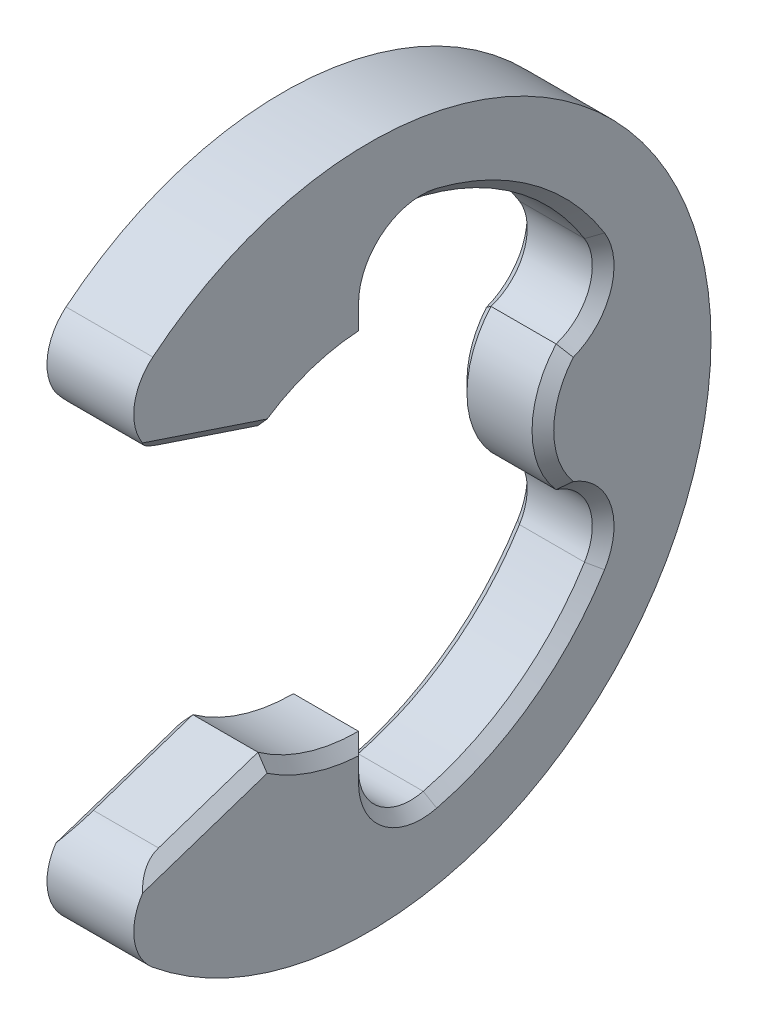
from build123d import *

# Parameters (mm, degrees)
EXTRUDE1_DEPTH          = 1
FILLET1_R               = 1.2
CUT_EXTRUDE1_DEPTH      = 12.181737343
CUT_EXTRUDE1_DEPTH_BACK = 12.181737343
CHAMFER1_SIZE           = 0.25


with BuildPart() as part:
    # Sketch1 → Extrude1 (new, symmetric)
    with BuildSketch(Plane(origin=(0, 0, 0), x_dir=(0, 0, -1), z_dir=(1, 0, 0))):
        with BuildLine():
            Line((-6.381117354, -4.614863629), (-2.317843826, -3.26))
            ThreePointArc((-2.317843826, -3.26), (-1.216552506, -3.810511777), (0, -4))
            Line((0, -4), (0, -6.129032258))
            ThreePointArc((0, -6.129032258), (3.615250795, -4.949242175), (5.8386874, -1.864072388))
            Line((5.8386874, -1.864072388), (3.810511777, -1.216552506))
            ThreePointArc((3.810511777, -1.216552506), (4, 0), (3.810511777, 1.216552506))
            Line((3.810511777, 1.216552506), (5.8386874, 1.864072388))
            ThreePointArc((5.8386874, 1.864072388), (3.615250795, 4.949242175), (0, 6.129032258))
            Line((0, 6.129032258), (0, 4))
            ThreePointArc((0, 4), (-1.216552506, 3.810511777), (-2.317843826, 3.26))
            Line((-2.317843826, 3.26), (-6.381117354, 4.614863629))
            ThreePointArc((-6.381117354, 4.614863629), (7.875, 0), (-6.381117354, -4.614863629))
        make_face()
    extrude(amount=EXTRUDE1_DEPTH, both=True)

    # Fillet1
    fillet1_edges = [part.edges().sort_by_distance(p)[0] for p in [
        (0, -4.614863629, 6.381117354),
        (0, -6.129032258, 0),
        (0, -1.864072388, -5.8386874),
        (0, 1.864072388, -5.8386874),
        (0, 6.129032258, 0),
        (0, 4.614863629, 6.381117354),
    ]]
    fillet(fillet1_edges, radius=FILLET1_R)

    # Sketch4 → Cut-Extrude1 (cut, two sides: drawn at the far end of the back side and taken through both)
    with BuildSketch(Plane(origin=(0, 0, 0), x_dir=(0, 0, -1), z_dir=(1, 0, 0)).offset(-CUT_EXTRUDE1_DEPTH_BACK)):
        with BuildLine():
            Line((0, 4.780727874), (0, -4.780727874))
            ThreePointArc((0, -4.780727874), (0.461953903, -5.726924448), (1.492146597, -5.944622356))
            ThreePointArc((1.492146597, -5.944622356), (3.615250795, -4.949242175), (5.209194703, -3.229446851))
            ThreePointArc((5.209194703, -3.229446851), (5.315130469, -2.181846269), (4.554254966, -1.454001619))
            ThreePointArc((4.554254966, -1.454001619), (4, 0), (4.554254966, 1.454001619))
            ThreePointArc((4.554254966, 1.454001619), (5.315130469, 2.181846269), (5.209194703, 3.229446851))
            ThreePointArc((5.209194703, 3.229446851), (3.615250795, 4.949242175), (1.492146597, 5.944622356))
            ThreePointArc((1.492146597, 5.944622356), (0.461953903, 5.726924448), (0, 4.780727874))
        make_face()
    extrude(amount=CUT_EXTRUDE1_DEPTH + CUT_EXTRUDE1_DEPTH_BACK, mode=Mode.SUBTRACT)

    # Chamfer1
    # the kernel refuses this chamfer: 0.25 mm, written as the material it takes off along each edge
    with BuildSketch(Plane(origin=(1, 3.056631288, 1.707935428), x_dir=(0, 0.9486525372163972, -0.31632003356235944), z_dir=(0, 0.31632003356235944, 0.9486525372163972)), Plane(origin=(-1, 3.056631288, 1.707935428), x_dir=(1, 0, 0), z_dir=(0, 0.31632003356235944, 0.9486525372163972)), Plane(origin=(-1, -4.370192178, 5.647340899), x_dir=(1, 0, 0), z_dir=(0, 0.3163200335623596, -0.9486525372163971))) as chamfer1_piece_1:
        Polygon((CHAMFER1_SIZE, 0), (0, CHAMFER1_SIZE), (0, 0), align=None)
    extrude(amount=4.15263262, mode=Mode.SUBTRACT)
    with BuildSketch(Plane(origin=(1, 0, 0), x_dir=(0, 0.9871090886928867, -0.16004888946787105), z_dir=(0, -0.16004888946787105, -0.9871090886928867))) as chamfer1_piece_2:
        Polygon((4 + CHAMFER1_SIZE, 0), (4, -CHAMFER1_SIZE), (4, 0), align=None)
    revolve(axis=Axis((1, 0, 0), (1, 0, 0)), revolution_arc=53.832106013, mode=Mode.SUBTRACT)
    with BuildSketch(Plane(origin=(1, 4.780727874, -1.2), x_dir=(0, 0, 1), z_dir=(0, -1, 0))) as chamfer1_piece_3:
        Polygon((1.2 + CHAMFER1_SIZE, 0), (1.2, CHAMFER1_SIZE), (1.2, 0), align=None)
    revolve(axis=Axis((1, 4.780727874, -1.2), (-1, 0, 0)), revolution_arc=104.090576784, mode=Mode.SUBTRACT)
    with BuildSketch(Plane(origin=(1, 0, 0), x_dir=(0, 0.5269097493911834, -0.8499212410550288), z_dir=(0, -0.8499212410550288, -0.5269097493911834))) as chamfer1_piece_4:
        Polygon((6.129032258 + CHAMFER1_SIZE, 0), (6.129032258, -CHAMFER1_SIZE), (6.129032258, 0), align=None)
    revolve(axis=Axis((1, 0, 0), (1, 0, 0)), revolution_arc=44.112527376, mode=Mode.SUBTRACT)
    with BuildSketch(Plane(origin=(1, 2.597155152, -4.189289214), x_dir=(0, 0.5269097493911832, -0.8499212410550289), z_dir=(0, 0.8499212410550289, 0.5269097493911832))) as chamfer1_piece_5:
        Polygon((1.2 + CHAMFER1_SIZE, 0), (1.2, CHAMFER1_SIZE), (1.2, 0), align=None)
    revolve(axis=Axis((1, 2.597155152, -4.189289214), (-1, 0, 0)), revolution_arc=134.804277629, mode=Mode.SUBTRACT)
    with BuildSketch(Plane(origin=(1, 0, -6.18430093), x_dir=(0, 0.8535787339825979, 0.5209638614075505), z_dir=(0, 0.5209638614075505, -0.8535787339825979))) as chamfer1_piece_6:
        Polygon((2.18430093 - CHAMFER1_SIZE, 0), (2.18430093, -CHAMFER1_SIZE), (2.18430093, 0), align=None)
    revolve(axis=Axis((1, 0, -6.18430093), (1, 0, 0)), revolution_arc=117.206144707, mode=Mode.SUBTRACT)
    with BuildSketch(Plane(origin=(1, -2.597155152, -4.189289214), x_dir=(0, 0.9743410747854011, 0.22507658693437918), z_dir=(0, -0.22507658693437918, 0.9743410747854011))) as chamfer1_piece_7:
        Polygon((1.2 + CHAMFER1_SIZE, 0), (1.2, CHAMFER1_SIZE), (1.2, 0), align=None)
    revolve(axis=Axis((1, -2.597155152, -4.189289214), (-1, 0, 0)), revolution_arc=134.804277629, mode=Mode.SUBTRACT)
    with BuildSketch(Plane(origin=(1, 0, 0), x_dir=(0, -0.9699120685888933, -0.24345549738219877), z_dir=(0, -0.24345549738219877, 0.9699120685888933))) as chamfer1_piece_8:
        Polygon((6.129032258 + CHAMFER1_SIZE, 0), (6.129032258, -CHAMFER1_SIZE), (6.129032258, 0), align=None)
    revolve(axis=Axis((1, 0, 0), (1, 0, 0)), revolution_arc=44.112527376, mode=Mode.SUBTRACT)
    with BuildSketch(Plane(origin=(1, -4.780727874, -1.2), x_dir=(0, -0.9699120685888935, -0.24345549738219882), z_dir=(0, 0.24345549738219882, -0.9699120685888935))) as chamfer1_piece_9:
        Polygon((1.2 + CHAMFER1_SIZE, 0), (1.2, CHAMFER1_SIZE), (1.2, 0), align=None)
    revolve(axis=Axis((1, -4.780727874, -1.2), (-1, 0, 0)), revolution_arc=104.090576784, mode=Mode.SUBTRACT)
    with BuildSketch(Plane(origin=(1, -3.357079253, 0), x_dir=(0, 0, 1), z_dir=(0, -1, 0)), Plane(origin=(-1, 4.780727874, 0), x_dir=(1, 0, 0), z_dir=(0, -1, 0)), Plane(origin=(-1, -3.357079253, 0), x_dir=(1, 0, 0), z_dir=(0, -1, 0)), Plane(origin=(1, 4.780727874, 0), x_dir=(0, 0, 1), z_dir=(0, -1, 0))) as chamfer1_piece_10:
        Polygon((CHAMFER1_SIZE, 0), (0, CHAMFER1_SIZE), (0, 0), align=None)
    extrude(amount=1.423648621, mode=Mode.SUBTRACT)
    with BuildSketch(Plane(origin=(1, 0, 0), x_dir=(0, -0.7117518247217879, 0.702431021528239), z_dir=(0, 0.702431021528239, 0.7117518247217879))) as chamfer1_piece_11:
        Polygon((4 + CHAMFER1_SIZE, 0), (4, -CHAMFER1_SIZE), (4, 0), align=None)
    revolve(axis=Axis((1, 0, 0), (1, 0, 0)), revolution_arc=53.832106013, mode=Mode.SUBTRACT)
    with BuildSketch(Plane(origin=(1, -4.370192178, 5.647340899), x_dir=(-1, 0, 0), z_dir=(0, 0.3163200335623596, -0.9486525372163971))) as chamfer1_piece_12:
        Polygon((CHAMFER1_SIZE, 0), (0, -CHAMFER1_SIZE), (0, 0), align=None)
    extrude(amount=4.15263262, mode=Mode.SUBTRACT)
    with BuildSketch(Plane(origin=(-1, 0, 0), x_dir=(0, 0.9871090886928867, -0.16004888946787105), z_dir=(0, -0.16004888946787105, -0.9871090886928867))) as chamfer1_piece_13:
        Polygon((4, CHAMFER1_SIZE), (4 + CHAMFER1_SIZE, 0), (4, 0), align=None)
    revolve(axis=Axis((-1, 0, 0), (1, 0, 0)), revolution_arc=53.832106013, mode=Mode.SUBTRACT)
    with BuildSketch(Plane(origin=(-1, 4.780727874, -1.2), x_dir=(0, 0, 1), z_dir=(0, -1, 0))) as chamfer1_piece_14:
        Polygon((1.2, -CHAMFER1_SIZE), (1.2 + CHAMFER1_SIZE, 0), (1.2, 0), align=None)
    revolve(axis=Axis((-1, 4.780727874, -1.2), (-1, 0, 0)), revolution_arc=104.090576784, mode=Mode.SUBTRACT)
    with BuildSketch(Plane(origin=(-1, 0, 0), x_dir=(0, 0.5269097493911834, -0.8499212410550288), z_dir=(0, -0.8499212410550288, -0.5269097493911834))) as chamfer1_piece_15:
        Polygon((6.129032258, CHAMFER1_SIZE), (6.129032258 + CHAMFER1_SIZE, 0), (6.129032258, 0), align=None)
    revolve(axis=Axis((-1, 0, 0), (1, 0, 0)), revolution_arc=44.112527376, mode=Mode.SUBTRACT)
    with BuildSketch(Plane(origin=(-1, 2.597155152, -4.189289214), x_dir=(0, 0.5269097493911832, -0.8499212410550289), z_dir=(0, 0.8499212410550289, 0.5269097493911832))) as chamfer1_piece_16:
        Polygon((1.2, -CHAMFER1_SIZE), (1.2 + CHAMFER1_SIZE, 0), (1.2, 0), align=None)
    revolve(axis=Axis((-1, 2.597155152, -4.189289214), (-1, 0, 0)), revolution_arc=134.804277629, mode=Mode.SUBTRACT)
    with BuildSketch(Plane(origin=(-1, 0, -6.18430093), x_dir=(0, -0.8535787339825973, 0.5209638614075514), z_dir=(0, -0.5209638614075514, -0.8535787339825973))) as chamfer1_piece_17:
        Polygon((2.18430093, -CHAMFER1_SIZE), (2.18430093 - CHAMFER1_SIZE, 0), (2.18430093, 0), align=None)
    revolve(axis=Axis((-1, 0, -6.18430093), (-1, 0, 0)), revolution_arc=117.206144707, mode=Mode.SUBTRACT)
    with BuildSketch(Plane(origin=(-1, -2.597155152, -4.189289214), x_dir=(0, 0.9743410747854011, 0.22507658693437918), z_dir=(0, -0.22507658693437918, 0.9743410747854011))) as chamfer1_piece_18:
        Polygon((1.2, -CHAMFER1_SIZE), (1.2 + CHAMFER1_SIZE, 0), (1.2, 0), align=None)
    revolve(axis=Axis((-1, -2.597155152, -4.189289214), (-1, 0, 0)), revolution_arc=134.804277629, mode=Mode.SUBTRACT)
    with BuildSketch(Plane(origin=(-1, 0, 0), x_dir=(0, -0.9699120685888933, -0.24345549738219877), z_dir=(0, -0.24345549738219877, 0.9699120685888933))) as chamfer1_piece_19:
        Polygon((6.129032258, CHAMFER1_SIZE), (6.129032258 + CHAMFER1_SIZE, 0), (6.129032258, 0), align=None)
    revolve(axis=Axis((-1, 0, 0), (1, 0, 0)), revolution_arc=44.112527376, mode=Mode.SUBTRACT)
    with BuildSketch(Plane(origin=(-1, -4.780727874, -1.2), x_dir=(0, -0.9699120685888935, -0.24345549738219882), z_dir=(0, 0.24345549738219882, -0.9699120685888935))) as chamfer1_piece_20:
        Polygon((1.2, -CHAMFER1_SIZE), (1.2 + CHAMFER1_SIZE, 0), (1.2, 0), align=None)
    revolve(axis=Axis((-1, -4.780727874, -1.2), (-1, 0, 0)), revolution_arc=104.090576784, mode=Mode.SUBTRACT)
    with BuildSketch(Plane(origin=(-1, 0, 0), x_dir=(0, -0.7117518247217879, 0.702431021528239), z_dir=(0, 0.702431021528239, 0.7117518247217879))) as chamfer1_piece_21:
        Polygon((4, CHAMFER1_SIZE), (4 + CHAMFER1_SIZE, 0), (4, 0), align=None)
    revolve(axis=Axis((-1, 0, 0), (1, 0, 0)), revolution_arc=53.832106013, mode=Mode.SUBTRACT)


solid = part.part
